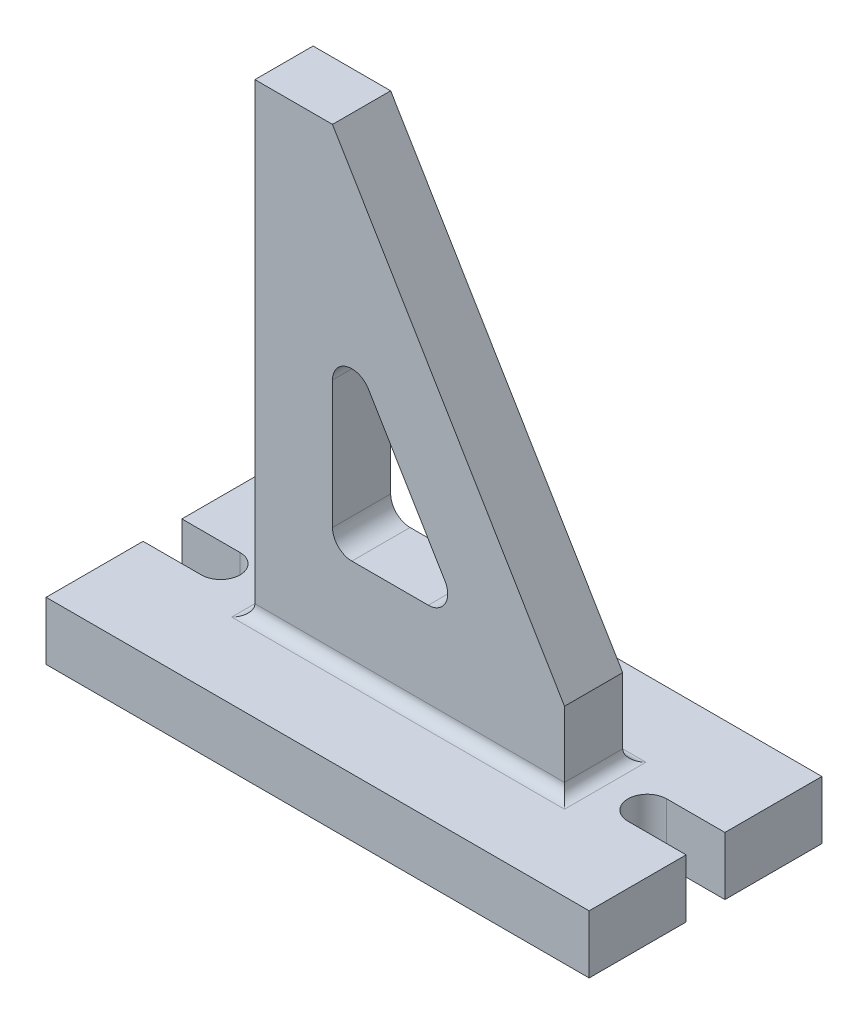
from build123d import *

# Parameters (mm, degrees)
SKETCH1_W                  = 177.8
SKETCH1_H                  = 76.2
MILLING_SUPPORT_BASE_DEPTH = 19.05
BOLT_SLOT_LEFT_END_DEPTH   = 111.168382488
BOLT_SLOT_RIGHT_END_DEPTH  = 111.168382488
OUTER_TRIANGLE_DEPTH       = 9.525
INNER_TRIANGLE_DEPTH       = 190.252372838
FILLET_AT_TRIANGLE_BASE_R  = 3.81


with BuildPart() as part:
    # Sketch1 → Milling Support Base (new body)
    with BuildSketch(Plane(origin=(0, 0, 0), x_dir=(1, 0, 0), z_dir=(0, 1, 0))):
        with Locations((12.7, 0)):
            Rectangle(SKETCH1_W, SKETCH1_H)
    extrude(amount=-MILLING_SUPPORT_BASE_DEPTH)

    # Sketch2 → Bolt Slot Left End (cut, through all)
    with BuildSketch(Plane(origin=(0, 0, 0), x_dir=(1, 0, 0), z_dir=(0, 1, 0))):
        with BuildLine():
            Line((-76.2, 6.35), (-57.15, 6.35))
            ThreePointArc((-57.15, 6.35), (-50.8, 0), (-57.15, -6.35))
            Line((-57.15, -6.35), (-76.2, -6.35))
            Line((-76.2, -6.35), (-76.2, 6.35))
        make_face()
    extrude(amount=-BOLT_SLOT_LEFT_END_DEPTH, mode=Mode.SUBTRACT)

    # Sketch3 → Bolt Slot Right End (cut, through all)
    with BuildSketch(Plane.XZ.offset(19.05)):
        with BuildLine():
            Line((101.6, 6.35), (82.55, 6.35))
            ThreePointArc((82.55, 6.35), (76.2, 0), (82.55, -6.35))
            Line((82.55, -6.35), (101.6, -6.35))
            Line((101.6, -6.35), (101.6, 6.35))
        make_face()
    extrude(amount=-BOLT_SLOT_RIGHT_END_DEPTH, mode=Mode.SUBTRACT)

    # Sketch4 → Outer Triangle (add, symmetric)
    with BuildSketch(Plane.XY):
        Polygon((-36.408550143, 0), (-36.408550143, 152.4), (-11.008550143, 152.4), (64.959238023, 25.4), (64.959238023, 0), align=None)
    extrude(amount=OUTER_TRIANGLE_DEPTH, both=True)

    # Sketch5 → Inner Triangle (cut, through all)
    with BuildSketch(Plane.XY.offset(9.525)):
        with BuildLine():
            Line((-4.658550143, 31.75), (20.365749185, 31.75))
            ThreePointArc((20.365749185, 31.75), (25.889412512, 34.967645701), (25.81522023, 41.359718598))
            Line((25.81522023, 41.359718598), (0.790920902, 83.194371039))
            ThreePointArc((0.790920902, 83.194371039), (-6.349460972, 86.055381202), (-11.008550143, 79.934652441))
            Line((-11.008550143, 79.934652441), (-11.008550143, 38.1))
            ThreePointArc((-11.008550143, 38.1), (-9.148678203, 33.609871939), (-4.658550143, 31.75))
        make_face()
    extrude(amount=-INNER_TRIANGLE_DEPTH, mode=Mode.SUBTRACT)

    # Fillet at Triangle base
    fillet_at_triangle_base_edges = [part.edges().sort_by_distance(p)[0] for p in [
        (14.27534394, 0, -9.525),
        (64.959238023, 0, 0),
        (14.27534394, 0, 9.525),
        (-36.408550143, 0, 0),
    ]]
    fillet(fillet_at_triangle_base_edges, radius=FILLET_AT_TRIANGLE_BASE_R)


solid = part.part
